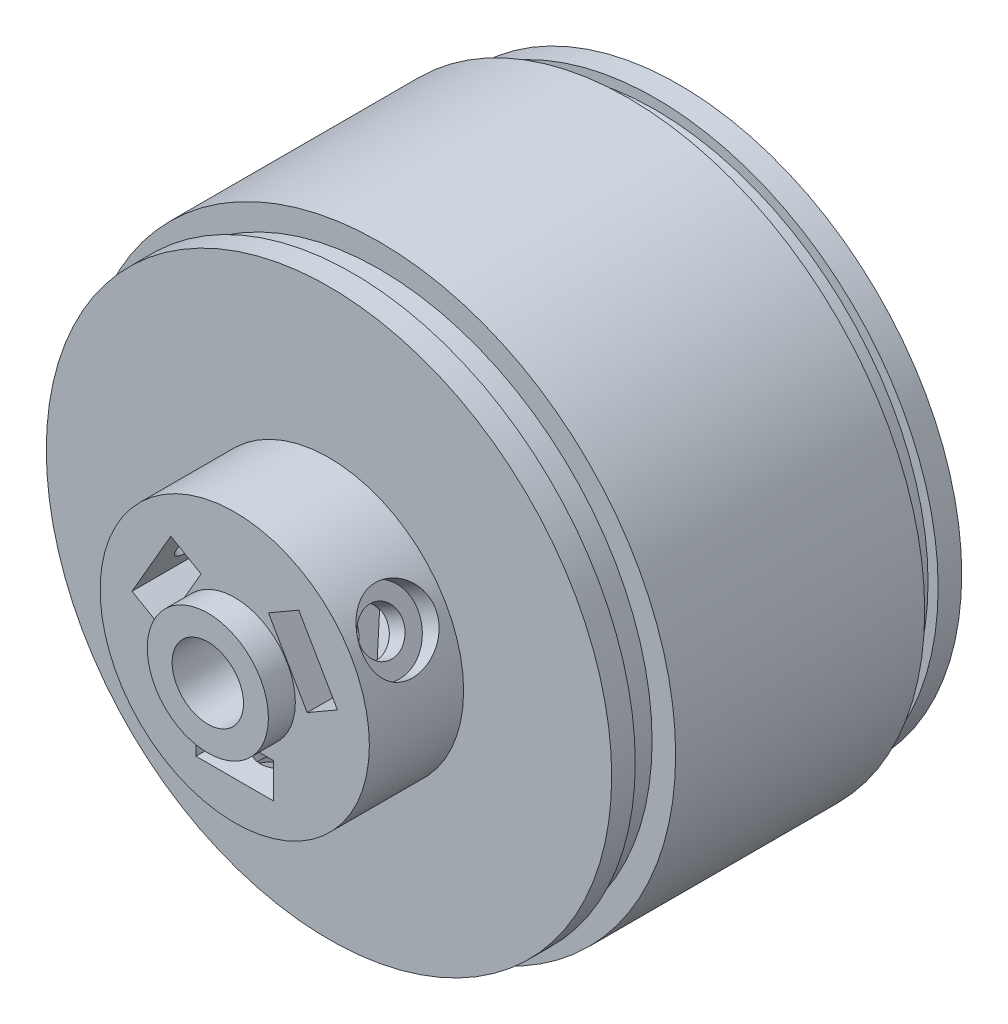
from build123d import *

# Parameters (mm, degrees)
EXTRUDE_1_OUTLINE_R      = 22
EXTRUDE_1_DEPTH          = 26
SKETCH_2_W               = 1.75
SKETCH_2_H               = 1
SKETCH_2_W_2             = 2
SKETCH_2_H_2             = 1.75
SKETCH_3_R               = 2.65
CUT_EXTRUDE_1_DEPTH      = 41.546269865
EXTRUDE_START            = 7
SKETCH_4_R               = 10
SKETCH_4_R_2             = 2.65
EXTRUDE_2_DEPTH          = 7
SKETCH_5_R               = 1.6
CUT_EXTRUDE_2_DEPTH      = 46.354161882
CUT_EXTRUDE_START        = -8.5
SKETCH_6_R               = 2.75
SKETCH_6_R_2             = 1.6
CUT_EXTRUDE_3_DEPTH      = 9
CUT_EXTRUDE_START_2      = -9.45
CUT_EXTRUDE_4_OUTLINE_R  = 1.6
CUT_EXTRUDE_4_DEPTH      = 2.6
PATTERN_CIRCULAR_1_COUNT = 3
EXTRUDE_START_2          = 2
SKETCH_8_R               = 4.5
SKETCH_8_R_2             = 2.65
EXTRUDE_3_DEPTH          = 2


# Read off the part's stored shape, not the designer's step: Бобышка-Вытянуть1, Вырез-Вытянуть4
with BuildPart() as part:
    # Бобышка-Вытянуть1 outline → Бобышка-Вытянуть1 (new body)
    with BuildSketch(Plane.XY):
        Circle(EXTRUDE_1_OUTLINE_R)
    extrude(amount=EXTRUDE_1_DEPTH)

    # Эскиз2 → Вырез-Повернуть1 (revolve, cut)
    with BuildSketch(Plane(origin=(0, 0, 0), x_dir=(0, 0, -1), z_dir=(1, 0, 0)), mode=Mode.PRIVATE) as cut_revolve_1_sk:
        Polygon((-3.75, 22), (-3.75, 20.25), (-1.75, 20.25), (-1.75, 21), (-1.75, 22), align=None)
        Polygon((-24.25, 21), (-24.25, 20.25), (-22.25, 20.25), (-22.25, 22), (-24.25, 22), align=None)
        with Locations((-25.125, 21.5)):
            Rectangle(SKETCH_2_W, SKETCH_2_H)
        with Locations((-23.25, 21.125)):
            Rectangle(SKETCH_2_W_2, SKETCH_2_H_2)
        with Locations((-2.75, 21.125)):
            Rectangle(SKETCH_2_W_2, SKETCH_2_H_2)
        with Locations((-0.875, 21.5)):
            Rectangle(SKETCH_2_W, SKETCH_2_H)
    revolve(cut_revolve_1_sk.sketch.rotate(Axis((0, 0, 0), (0, 0, 1)), 90), axis=Axis((0, 0, 0), (0, 0, 1)), mode=Mode.SUBTRACT)

    # Эскиз3 → Вырез-Вытянуть1 (cut, through all)
    with BuildSketch(Plane.XY.offset(26)):
        Circle(SKETCH_3_R)
    extrude(amount=-CUT_EXTRUDE_1_DEPTH, mode=Mode.SUBTRACT)

    # Эскиз4 → Бобышка-Вытянуть2 (add)
    with BuildSketch(Plane.XY.offset(26).offset(EXTRUDE_START)):
        Circle(SKETCH_4_R)
        Circle(SKETCH_4_R_2, mode=Mode.SUBTRACT)
    extrude(amount=-EXTRUDE_2_DEPTH)

    # Эскиз5 → Вырез-Вытянуть2 (cut, through all)
    with BuildSketch(Plane(origin=(0, 0, 0), x_dir=(1, 0, 0), z_dir=(0, 1, 0))):
        with Locations(Location((0, -29.5, 0), (0, 0, 270))):
            Circle(SKETCH_5_R)
    cut_extrude_2 = extrude(amount=-CUT_EXTRUDE_2_DEPTH, mode=Mode.SUBTRACT)

    # Эскиз6 → Вырез-Вытянуть3 (cut)
    with BuildSketch(Plane(origin=(0, 0, 0), x_dir=(1, 0, 0), z_dir=(0, 1, 0)).offset(CUT_EXTRUDE_START)):
        with Locations(Location((0, -29.5, 0), (0, 0, 270))):
            Circle(SKETCH_6_R)
        with Locations(Location((0, -29.5, 0), (0, 0, 270))):
            Circle(SKETCH_6_R_2, mode=Mode.SUBTRACT)
    cut_extrude_3 = extrude(amount=-CUT_EXTRUDE_3_DEPTH, mode=Mode.SUBTRACT)

    # Вырез-Вытянуть4 outline → Вырез-Вытянуть4 (cut)
    with BuildSketch(Plane.XZ.offset(14).offset(CUT_EXTRUDE_START_2)):
        Polygon((-2.875, 27.840117976), (0, 26.180235952), (2.875, 27.840117976), (2.875, 33), (-2.875, 33), align=None)
        with Locations((0, 29.5)):
            Circle(CUT_EXTRUDE_4_OUTLINE_R, mode=Mode.SUBTRACT)
    cut_extrude_4 = extrude(amount=CUT_EXTRUDE_4_DEPTH, mode=Mode.SUBTRACT)

    # Круговой массив1: Вырез-Вытянуть2, Вырез-Вытянуть3, Вырез-Вытянуть4 ×3 about axis
    pattern_circular_1_axis = Axis((0, 0, 0), (0, 0, 1))
    add([cut_extrude_2.rotate(pattern_circular_1_axis, i * 360 / PATTERN_CIRCULAR_1_COUNT) for i in range(1, PATTERN_CIRCULAR_1_COUNT)], mode=Mode.SUBTRACT)
    add([cut_extrude_3.rotate(pattern_circular_1_axis, i * 360 / PATTERN_CIRCULAR_1_COUNT) for i in range(1, PATTERN_CIRCULAR_1_COUNT)], mode=Mode.SUBTRACT)
    add([cut_extrude_4.rotate(pattern_circular_1_axis, i * 360 / PATTERN_CIRCULAR_1_COUNT) for i in range(1, PATTERN_CIRCULAR_1_COUNT)], mode=Mode.SUBTRACT)

    # Эскиз8 → Бобышка-Вытянуть3 (add)
    with BuildSketch(Plane.XY.offset(33).offset(EXTRUDE_START_2)):
        Circle(SKETCH_8_R)
        Circle(SKETCH_8_R_2, mode=Mode.SUBTRACT)
    extrude(amount=-EXTRUDE_3_DEPTH)


solid = part.part
